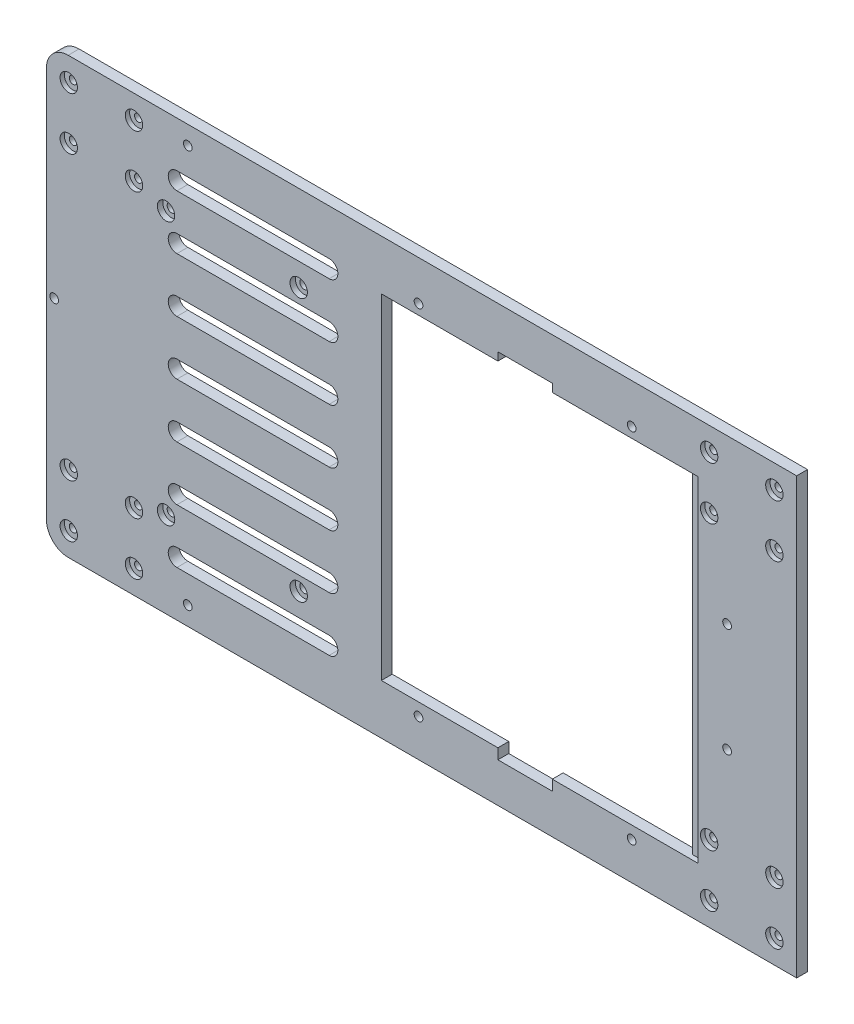
from build123d import *

# Parameters (mm, degrees)
SKETCH_1_W               = 300
SKETCH_1_H               = 200
EXTRUDE_1_DEPTH          = 5
MOVE_BODY_1_OUTLINE_W    = 30
MOVE_BODY_1_OUTLINE_H    = 5
MOVE_BODY_1_DEPTH        = 200
MOVE_BODY_1_2_OUTLINE_W  = 30
MOVE_BODY_1_2_OUTLINE_H  = 5
MOVE_BODY_1_2_DEPTH      = 200
SKETCH_13_W              = 30
SKETCH_13_H              = 5
EXTRUDE_2_DEPTH          = 200
CUT_EXTRUDE_1_REACH      = 362.59
SKETCH_2_R               = 1.75
MIRROR_2_COPY_1_REACH    = 362.59
MIRROR_2_COPY_1_SKETCH_R = 1.75
SKETCH_5_R               = 4
CUT_EXTRUDE_4_DEPTH      = 2
FILLET_1_R               = 10
CUT_EXTRUDE_5_REACH      = 362.59
SKETCH_6_R               = 2
CUT_EXTRUDE_8_REACH      = 362.59
PATTERN_LINEAR_2_COUNT   = 4
PATTERN_LINEAR_2_PITCH   = 25
PATTERN_LINEAR_3_COUNT   = 4
PATTERN_LINEAR_3_PITCH   = 25
CUT_EXTRUDE_12_REACH     = 362.59
SKETCH_15_R              = 2
SKETCH_17_R              = 4
CUT_EXTRUDE_14_DEPTH     = 2.5
SKETCH_19_W              = 15
SKETCH_19_H              = 5
EXTRUDE_3_DEPTH          = 200
CUT_EXTRUDE_16_REACH     = 375.162
SKETCH_20_W              = 141
SKETCH_20_H              = 154
SKETCH_21_W              = 4.522273238
SKETCH_21_H              = 154
CUT_EXTRUDE_17_DEPTH     = 2.2
CUT_EXTRUDE_18_REACH     = 375.162
SKETCH_18_W              = 25
SKETCH_18_H              = 8
CUT_EXTRUDE_19_REACH     = 375.162
SKETCH_14_R              = 2
CUT_EXTRUDE_20_REACH     = 375.162
SKETCH_11_R              = 2


# Read off the part's stored shape, not the designer's step: 实体-移动/复制1
with BuildPart() as part:
    # 草图1 → 凸台-拉伸1 (new body)
    with BuildSketch(Plane.XY):
        with Locations((150, 100)):
            Rectangle(SKETCH_1_W, SKETCH_1_H)
    extrude(amount=EXTRUDE_1_DEPTH)


with BuildPart() as body_2:
    # Split Bodies 1: the piece on the far side of the plane
    add(part.part)
    split(bisect_by=Plane(origin=(150, 0, 0), x_dir=(0, 0, -1), z_dir=(-1, 0, 0)), keep=Keep.BOTTOM)


with BuildPart() as part_1:
    add(part.part)

    # Split Bodies 1
    split(bisect_by=Plane(origin=(150, 0, 0), x_dir=(0, 0, -1), z_dir=(-1, 0, 0)), keep=Keep.TOP)

    # Move Body 1 outline → Move Body 1 (cut)
    with BuildSketch(Plane(origin=(0, 0, 0), x_dir=(1, 0, 0), z_dir=(0, 1, 0))):
        with Locations((135, -2.5)):
            Rectangle(MOVE_BODY_1_OUTLINE_W, MOVE_BODY_1_OUTLINE_H)
    extrude(amount=MOVE_BODY_1_DEPTH, mode=Mode.SUBTRACT)

    # Move Body 1 2 outline → Move Body 1 2 (add)
    with BuildSketch(Plane(origin=(0, 0, 0), x_dir=(1, 0, 0), z_dir=(0, 1, 0))):
        with Locations((-15, -2.5)):
            Rectangle(MOVE_BODY_1_2_OUTLINE_W, MOVE_BODY_1_2_OUTLINE_H)
    extrude(amount=MOVE_BODY_1_2_DEPTH)

    add(body_2.part)  # 凸台-拉伸2 merges body 2
    # 草图13 → 凸台-拉伸2 (add)
    with BuildSketch(Plane.XZ):
        with Locations((135, 2.5)):
            Rectangle(SKETCH_13_W, SKETCH_13_H)
    extrude(amount=-EXTRUDE_2_DEPTH)

    # 草图2 → 切除-拉伸1 (cut, up to next)
    with BuildSketch(Plane(origin=(0, 0, 0), x_dir=(-1, 0, 0), z_dir=(0, 0, -1)), mode=Mode.PRIVATE) as cut_extrude_1_sk1:
        with Locations((-10.25, 189.25)):
            Circle(SKETCH_2_R)
    cut_extrude_1_tool1 = extrude(cut_extrude_1_sk1.sketch, amount=-CUT_EXTRUDE_1_REACH, mode=Mode.PRIVATE) & part_1.part
    # 草图2 → 切除-拉伸1 (cut, up to next)
    with BuildSketch(Plane(origin=(0, 0, 0), x_dir=(-1, 0, 0), z_dir=(0, 0, -1)), mode=Mode.PRIVATE) as cut_extrude_1_sk2:
        with Locations((19.75, 189.25)):
            Circle(SKETCH_2_R)
    cut_extrude_1_tool2 = extrude(cut_extrude_1_sk2.sketch, amount=-CUT_EXTRUDE_1_REACH, mode=Mode.PRIVATE) & part_1.part
    # 草图2 → 切除-拉伸1 (cut, up to next)
    with BuildSketch(Plane(origin=(0, 0, 0), x_dir=(-1, 0, 0), z_dir=(0, 0, -1)), mode=Mode.PRIVATE) as cut_extrude_1_sk3:
        with Locations((19.75, 165.05)):
            Circle(SKETCH_2_R)
    cut_extrude_1_tool3 = extrude(cut_extrude_1_sk3.sketch, amount=-CUT_EXTRUDE_1_REACH, mode=Mode.PRIVATE) & part_1.part
    # 草图2 → 切除-拉伸1 (cut, up to next)
    with BuildSketch(Plane(origin=(0, 0, 0), x_dir=(-1, 0, 0), z_dir=(0, 0, -1)), mode=Mode.PRIVATE) as cut_extrude_1_sk4:
        with Locations((-10.25, 165.05)):
            Circle(SKETCH_2_R)
    cut_extrude_1_tool4 = extrude(cut_extrude_1_sk4.sketch, amount=-CUT_EXTRUDE_1_REACH, mode=Mode.PRIVATE) & part_1.part
    cut_extrude_1_1 = cut_extrude_1_tool1.solids().sort_by_distance((10.25, 189.25, 0))[0]
    add(cut_extrude_1_1, mode=Mode.SUBTRACT)
    cut_extrude_1_2 = cut_extrude_1_tool2.solids().sort_by_distance((-19.75, 189.25, 0))[0]
    add(cut_extrude_1_2, mode=Mode.SUBTRACT)
    cut_extrude_1_3 = cut_extrude_1_tool3.solids().sort_by_distance((-19.75, 165.05, 0))[0]
    add(cut_extrude_1_3, mode=Mode.SUBTRACT)
    cut_extrude_1_4 = cut_extrude_1_tool4.solids().sort_by_distance((10.25, 165.05, 0))[0]
    add(cut_extrude_1_4, mode=Mode.SUBTRACT)
    cut_extrude_1 = cut_extrude_1_1 + cut_extrude_1_2 + cut_extrude_1_3 + cut_extrude_1_4  # 切除-拉伸1 as one shape, for the pattern or mirror that repeats it

    # 镜向1: 切除-拉伸1 across plane
    add(cut_extrude_1.mirror(Plane.ZX.offset(100)), mode=Mode.SUBTRACT)

    # 镜向2: 切除-拉伸1 across plane
    add(cut_extrude_1.mirror(Plane(origin=(135, 0, 0), x_dir=(0, 0, 1), z_dir=(1, 0, 0))), mode=Mode.SUBTRACT)

    # 镜向2 copy 1 sketch → 镜向2 copy 1 (cut, up to next)
    with BuildSketch(Plane(origin=(270, 200, 0), x_dir=(1, 0, 0), z_dir=(0, 0, -1)), mode=Mode.PRIVATE) as mirror_2_copy_1_sk1:
        with Locations((-10.25, 189.25)):
            Circle(MIRROR_2_COPY_1_SKETCH_R)
    mirror_2_copy_1_tool1 = extrude(mirror_2_copy_1_sk1.sketch, amount=-MIRROR_2_COPY_1_REACH, mode=Mode.PRIVATE) & part_1.part
    # 镜向2 copy 1 sketch → 镜向2 copy 1 (cut, up to next)
    with BuildSketch(Plane(origin=(270, 200, 0), x_dir=(1, 0, 0), z_dir=(0, 0, -1)), mode=Mode.PRIVATE) as mirror_2_copy_1_sk2:
        with Locations((19.75, 189.25)):
            Circle(MIRROR_2_COPY_1_SKETCH_R)
    mirror_2_copy_1_tool2 = extrude(mirror_2_copy_1_sk2.sketch, amount=-MIRROR_2_COPY_1_REACH, mode=Mode.PRIVATE) & part_1.part
    # 镜向2 copy 1 sketch → 镜向2 copy 1 (cut, up to next)
    with BuildSketch(Plane(origin=(270, 200, 0), x_dir=(1, 0, 0), z_dir=(0, 0, -1)), mode=Mode.PRIVATE) as mirror_2_copy_1_sk3:
        with Locations((19.75, 165.05)):
            Circle(MIRROR_2_COPY_1_SKETCH_R)
    mirror_2_copy_1_tool3 = extrude(mirror_2_copy_1_sk3.sketch, amount=-MIRROR_2_COPY_1_REACH, mode=Mode.PRIVATE) & part_1.part
    # 镜向2 copy 1 sketch → 镜向2 copy 1 (cut, up to next)
    with BuildSketch(Plane(origin=(270, 200, 0), x_dir=(1, 0, 0), z_dir=(0, 0, -1)), mode=Mode.PRIVATE) as mirror_2_copy_1_sk4:
        with Locations((-10.25, 165.05)):
            Circle(MIRROR_2_COPY_1_SKETCH_R)
    mirror_2_copy_1_tool4 = extrude(mirror_2_copy_1_sk4.sketch, amount=-MIRROR_2_COPY_1_REACH, mode=Mode.PRIVATE) & part_1.part
    add(mirror_2_copy_1_tool1.solids().sort_by_distance((259.75, 10.75, 0))[0], mode=Mode.SUBTRACT)
    add(mirror_2_copy_1_tool2.solids().sort_by_distance((289.75, 10.75, 0))[0], mode=Mode.SUBTRACT)
    add(mirror_2_copy_1_tool3.solids().sort_by_distance((289.75, 34.95, 0))[0], mode=Mode.SUBTRACT)
    add(mirror_2_copy_1_tool4.solids().sort_by_distance((259.75, 34.95, 0))[0], mode=Mode.SUBTRACT)

    # 草图5 → 切除-拉伸4 (cut)
    with BuildSketch(Plane.XY.offset(5)):
        with Locations((-19.75, 189.25)):
            Circle(SKETCH_5_R)
        with Locations((-19.75, 165.05)):
            Circle(SKETCH_5_R)
        with Locations((10.25, 189.25)):
            Circle(SKETCH_5_R)
        with Locations((10.25, 165.05)):
            Circle(SKETCH_5_R)
        with Locations(Location((10.25, 34.95, 0), (0, 0, 180))):
            Circle(SKETCH_5_R)
        with Locations(Location((10.25, 10.75, 0), (0, 0, 180))):
            Circle(SKETCH_5_R)
        with Locations(Location((-19.75, 34.95, 0), (0, 0, 180))):
            Circle(SKETCH_5_R)
        with Locations(Location((-19.75, 10.75, 0), (0, 0, 180))):
            Circle(SKETCH_5_R)
        with Locations((289.75, 10.75)):
            Circle(SKETCH_5_R)
        with Locations((289.75, 34.95)):
            Circle(SKETCH_5_R)
        with Locations((259.75, 10.75)):
            Circle(SKETCH_5_R)
        with Locations((259.75, 34.95)):
            Circle(SKETCH_5_R)
        with Locations(Location((259.75, 165.05, 0), (0, 0, 180))):
            Circle(SKETCH_5_R)
        with Locations(Location((259.75, 189.25, 0), (0, 0, 180))):
            Circle(SKETCH_5_R)
        with Locations(Location((289.75, 165.05, 0), (0, 0, 180))):
            Circle(SKETCH_5_R)
        with Locations(Location((289.75, 189.25, 0), (0, 0, 180))):
            Circle(SKETCH_5_R)
    extrude(amount=-CUT_EXTRUDE_4_DEPTH, mode=Mode.SUBTRACT)

    # 圆角1
    fillet_1_edges = [part_1.edges().sort_by_distance(p)[0] for p in [
        (-30, 200, 2.5),
        (-30, 0, 2.5),
    ]]
    fillet(fillet_1_edges, radius=FILLET_1_R)

    # 草图6 → 切除-拉伸5 (cut, up to next)
    with BuildSketch(Plane.XY.offset(5), mode=Mode.PRIVATE) as cut_extrude_5_sk1:
        with Locations((35, 191.504064166)):
            Circle(SKETCH_6_R)
    cut_extrude_5_tool1 = extrude(cut_extrude_5_sk1.sketch, amount=-CUT_EXTRUDE_5_REACH, mode=Mode.PRIVATE) & part_1.part
    # 草图6 → 切除-拉伸5 (cut, up to next)
    with BuildSketch(Plane.XY.offset(5), mode=Mode.PRIVATE) as cut_extrude_5_sk2:
        with Locations((35, 8.495935834)):
            Circle(SKETCH_6_R)
    cut_extrude_5_tool2 = extrude(cut_extrude_5_sk2.sketch, amount=-CUT_EXTRUDE_5_REACH, mode=Mode.PRIVATE) & part_1.part
    # 草图6 → 切除-拉伸5 (cut, up to next)
    with BuildSketch(Plane.XY.offset(5), mode=Mode.PRIVATE) as cut_extrude_5_sk3:
        with Locations((-26.443105822, 100)):
            Circle(SKETCH_6_R)
    cut_extrude_5_tool3 = extrude(cut_extrude_5_sk3.sketch, amount=-CUT_EXTRUDE_5_REACH, mode=Mode.PRIVATE) & part_1.part
    add(cut_extrude_5_tool1.solids().sort_by_distance((35, 191.504064, 5))[0], mode=Mode.SUBTRACT)
    add(cut_extrude_5_tool2.solids().sort_by_distance((35, 8.495936, 5))[0], mode=Mode.SUBTRACT)
    add(cut_extrude_5_tool3.solids().sort_by_distance((-26.443106, 100, 5))[0], mode=Mode.SUBTRACT)

    # 草图10 → 切除-拉伸8 (cut, up to next)
    with BuildSketch(Plane.XY.offset(5), mode=Mode.PRIVATE) as cut_extrude_8_sk1:
        with BuildLine():
            Line((30, 104), (100, 104))
            ThreePointArc((100, 104), (104, 100), (100, 96))
            Line((100, 96), (30, 96))
            ThreePointArc((30, 96), (26, 100), (30, 104))
        make_face()
    cut_extrude_8_tool1 = extrude(cut_extrude_8_sk1.sketch, amount=-CUT_EXTRUDE_8_REACH, mode=Mode.PRIVATE) & part_1.part
    cut_extrude_8 = cut_extrude_8_tool1.solids().sort_by_distance((65, 100, 5))[0]
    add(cut_extrude_8, mode=Mode.SUBTRACT)

    # 阵列(线性)2: 切除-拉伸8 ×4
    with Locations(*[(0, i * PATTERN_LINEAR_2_PITCH, 0) for i in range(1, PATTERN_LINEAR_2_COUNT)]):
        add(cut_extrude_8, mode=Mode.SUBTRACT)

    # 阵列(线性)3: 切除-拉伸8 ×4
    with Locations(*[(0, -i * PATTERN_LINEAR_3_PITCH, 0) for i in range(1, PATTERN_LINEAR_3_COUNT)]):
        add(cut_extrude_8, mode=Mode.SUBTRACT)

    # 草图15 → 切除-拉伸12 (cut, up to next)
    with BuildSketch(Plane(origin=(0, 0, 0), x_dir=(-1, 0, 0), z_dir=(0, 0, -1)), mode=Mode.PRIVATE) as cut_extrude_12_sk1:
        with Locations((-25, 39.5)):
            Circle(SKETCH_15_R)
    cut_extrude_12_tool1 = extrude(cut_extrude_12_sk1.sketch, amount=-CUT_EXTRUDE_12_REACH, mode=Mode.PRIVATE) & part_1.part
    # 草图15 → 切除-拉伸12 (cut, up to next)
    with BuildSketch(Plane(origin=(0, 0, 0), x_dir=(-1, 0, 0), z_dir=(0, 0, -1)), mode=Mode.PRIVATE) as cut_extrude_12_sk2:
        with Locations((-86, 39.5)):
            Circle(SKETCH_15_R)
    cut_extrude_12_tool2 = extrude(cut_extrude_12_sk2.sketch, amount=-CUT_EXTRUDE_12_REACH, mode=Mode.PRIVATE) & part_1.part
    # 草图15 → 切除-拉伸12 (cut, up to next)
    with BuildSketch(Plane(origin=(0, 0, 0), x_dir=(-1, 0, 0), z_dir=(0, 0, -1)), mode=Mode.PRIVATE) as cut_extrude_12_sk3:
        with Locations((-86, 160.5)):
            Circle(SKETCH_15_R)
    cut_extrude_12_tool3 = extrude(cut_extrude_12_sk3.sketch, amount=-CUT_EXTRUDE_12_REACH, mode=Mode.PRIVATE) & part_1.part
    # 草图15 → 切除-拉伸12 (cut, up to next)
    with BuildSketch(Plane(origin=(0, 0, 0), x_dir=(-1, 0, 0), z_dir=(0, 0, -1)), mode=Mode.PRIVATE) as cut_extrude_12_sk4:
        with Locations((-25, 160.5)):
            Circle(SKETCH_15_R)
    cut_extrude_12_tool4 = extrude(cut_extrude_12_sk4.sketch, amount=-CUT_EXTRUDE_12_REACH, mode=Mode.PRIVATE) & part_1.part
    add(cut_extrude_12_tool1.solids().sort_by_distance((25, 39.5, 0))[0], mode=Mode.SUBTRACT)
    add(cut_extrude_12_tool2.solids().sort_by_distance((86, 39.5, 0))[0], mode=Mode.SUBTRACT)
    add(cut_extrude_12_tool3.solids().sort_by_distance((86, 160.5, 0))[0], mode=Mode.SUBTRACT)
    add(cut_extrude_12_tool4.solids().sort_by_distance((25, 160.5, 0))[0], mode=Mode.SUBTRACT)

    # 草图17 → 切除-拉伸14 (cut)
    with BuildSketch(Plane.XY.offset(5)):
        with Locations((25, 160.5)):
            Circle(SKETCH_17_R)
        with Locations((86, 160.5)):
            Circle(SKETCH_17_R)
        with Locations((86, 39.5)):
            Circle(SKETCH_17_R)
        with Locations((25, 39.5)):
            Circle(SKETCH_17_R)
    extrude(amount=-CUT_EXTRUDE_14_DEPTH, mode=Mode.SUBTRACT)


with BuildPart() as body_2_2:
    # Split Bodies 2: the piece on the far side of the plane
    add(part_1.part)
    split(bisect_by=Plane(origin=(125, 0, 0), x_dir=(0, 0, 1), z_dir=(1, 0, 0)), keep=Keep.BOTTOM)


with BuildPart() as part_2:
    add(part_1.part)

    # Split Bodies 2
    split(bisect_by=Plane(origin=(125, 0, 0), x_dir=(0, 0, 1), z_dir=(1, 0, 0)), keep=Keep.TOP)


with BuildPart() as part_3:
    # Move Body 2: moved
    add(part_2.part.moved(Location((15, 0, 0))))


    add(body_2_2.part)  # 凸台-拉伸3 merges body 2 2
    # 草图19 → 凸台-拉伸3 (add)
    with BuildSketch(Plane.XZ):
        with Locations((132.5, 2.5)):
            Rectangle(SKETCH_19_W, SKETCH_19_H)
    extrude(amount=-EXTRUDE_3_DEPTH)

    # 草图20 → 切除-拉伸16 (cut, up to next)
    with BuildSketch(Plane.XY.offset(5), mode=Mode.PRIVATE) as cut_extrude_16_sk1:
        with Locations((194.5, 100)):
            Rectangle(SKETCH_20_W, SKETCH_20_H)
    cut_extrude_16_tool1 = extrude(cut_extrude_16_sk1.sketch, amount=-CUT_EXTRUDE_16_REACH, mode=Mode.PRIVATE) & part_3.part
    add(cut_extrude_16_tool1.solids().sort_by_distance((194.5, 100, 5))[0], mode=Mode.SUBTRACT)

    # 草图21 → 切除-拉伸17 (cut)
    with BuildSketch(Plane.XY.offset(5)):
        with Locations((267.261136619, 100)):
            Rectangle(SKETCH_21_W, SKETCH_21_H)
    extrude(amount=-CUT_EXTRUDE_17_DEPTH, mode=Mode.SUBTRACT)

    # 草图18 → 切除-拉伸18 (cut, up to next)
    with BuildSketch(Plane.XY.offset(5), mode=Mode.PRIVATE) as cut_extrude_18_sk1:
        with Locations((190.105739272, 22.2)):
            Rectangle(SKETCH_18_W, SKETCH_18_H)
    cut_extrude_18_tool1 = extrude(cut_extrude_18_sk1.sketch, amount=-CUT_EXTRUDE_18_REACH, mode=Mode.PRIVATE) & part_3.part
    # 草图18 → 切除-拉伸18 (cut, up to next)
    with BuildSketch(Plane.XY.offset(5), mode=Mode.PRIVATE) as cut_extrude_18_sk2:
        with Locations((190.105739272, 176.705873107)):
            Rectangle(SKETCH_18_W, SKETCH_18_H)
    cut_extrude_18_tool2 = extrude(cut_extrude_18_sk2.sketch, amount=-CUT_EXTRUDE_18_REACH, mode=Mode.PRIVATE) & part_3.part
    add(cut_extrude_18_tool1.solids().sort_by_distance((190.105739, 22.2, 5))[0], mode=Mode.SUBTRACT)
    add(cut_extrude_18_tool2.solids().sort_by_distance((190.105739, 176.705873, 5))[0], mode=Mode.SUBTRACT)

    # 草图14 → 切除-拉伸19 (cut, up to next)
    with BuildSketch(Plane.XY.offset(5), mode=Mode.PRIVATE) as cut_extrude_19_sk1:
        with Locations((141.105739272, 17.2)):
            Circle(SKETCH_14_R)
    cut_extrude_19_tool1 = extrude(cut_extrude_19_sk1.sketch, amount=-CUT_EXTRUDE_19_REACH, mode=Mode.PRIVATE) & part_3.part
    # 草图14 → 切除-拉伸19 (cut, up to next)
    with BuildSketch(Plane.XY.offset(5), mode=Mode.PRIVATE) as cut_extrude_19_sk2:
        with Locations((239.105739272, 17.2)):
            Circle(SKETCH_14_R)
    cut_extrude_19_tool2 = extrude(cut_extrude_19_sk2.sketch, amount=-CUT_EXTRUDE_19_REACH, mode=Mode.PRIVATE) & part_3.part
    # 草图14 → 切除-拉伸19 (cut, up to next)
    with BuildSketch(Plane.XY.offset(5), mode=Mode.PRIVATE) as cut_extrude_19_sk3:
        with Locations((239.105739272, 181.705873107)):
            Circle(SKETCH_14_R)
    cut_extrude_19_tool3 = extrude(cut_extrude_19_sk3.sketch, amount=-CUT_EXTRUDE_19_REACH, mode=Mode.PRIVATE) & part_3.part
    # 草图14 → 切除-拉伸19 (cut, up to next)
    with BuildSketch(Plane.XY.offset(5), mode=Mode.PRIVATE) as cut_extrude_19_sk4:
        with Locations((141.105739272, 181.705873107)):
            Circle(SKETCH_14_R)
    cut_extrude_19_tool4 = extrude(cut_extrude_19_sk4.sketch, amount=-CUT_EXTRUDE_19_REACH, mode=Mode.PRIVATE) & part_3.part
    add(cut_extrude_19_tool1.solids().sort_by_distance((141.105739, 17.2, 5))[0], mode=Mode.SUBTRACT)
    add(cut_extrude_19_tool2.solids().sort_by_distance((239.105739, 17.2, 5))[0], mode=Mode.SUBTRACT)
    add(cut_extrude_19_tool3.solids().sort_by_distance((239.105739, 181.705873, 5))[0], mode=Mode.SUBTRACT)
    add(cut_extrude_19_tool4.solids().sort_by_distance((141.105739, 181.705873, 5))[0], mode=Mode.SUBTRACT)

    # 草图11 → 切除-拉伸20 (cut, up to next)
    with BuildSketch(Plane.XY.offset(5), mode=Mode.PRIVATE) as cut_extrude_20_sk1:
        with Locations((283, 125)):
            Circle(SKETCH_11_R)
    cut_extrude_20_tool1 = extrude(cut_extrude_20_sk1.sketch, amount=-CUT_EXTRUDE_20_REACH, mode=Mode.PRIVATE) & part_3.part
    # 草图11 → 切除-拉伸20 (cut, up to next)
    with BuildSketch(Plane.XY.offset(5), mode=Mode.PRIVATE) as cut_extrude_20_sk2:
        with Locations((283, 75)):
            Circle(SKETCH_11_R)
    cut_extrude_20_tool2 = extrude(cut_extrude_20_sk2.sketch, amount=-CUT_EXTRUDE_20_REACH, mode=Mode.PRIVATE) & part_3.part
    add(cut_extrude_20_tool1.solids().sort_by_distance((283, 125, 5))[0], mode=Mode.SUBTRACT)
    add(cut_extrude_20_tool2.solids().sort_by_distance((283, 75, 5))[0], mode=Mode.SUBTRACT)


solid = part_3.part
